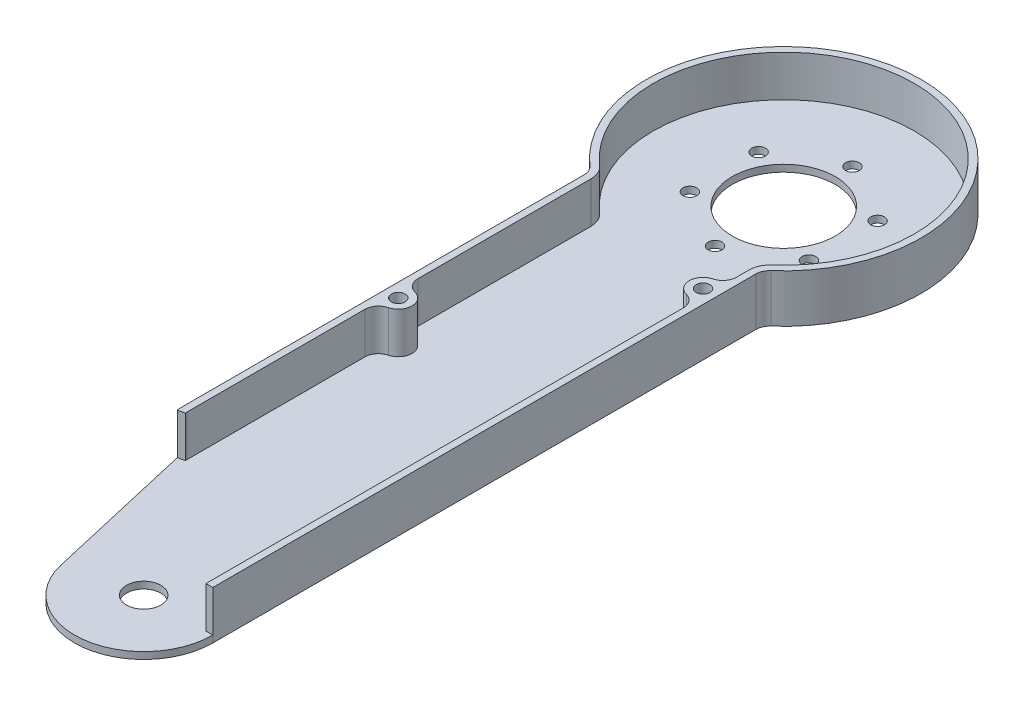
from build123d import *

# Parameters (mm, degrees)
SKETCH1_R           = 1.27
SKETCH1_R_2         = 3.175
SKETCH1_R_3         = 9.525
BOSS_EXTRUDE1_DEPTH = 8.89
FILLET1_R           = 2.54
SHELL2_START        = 1.27
SHELL2_OUTLINE_R    = 3.175
SHELL2_OUTLINE_R_2  = 1.27
SHELL2_OUTLINE_R_3  = 9.525
SHELL2_DEPTH        = 7.62
FILLET2_R           = 2.54


# Read off the part's stored shape, not the designer's step: Shell2
with BuildPart() as part:
    # Sketch1 → Boss-Extrude1 (new body)
    with BuildSketch(Plane(origin=(0, 0, 0), x_dir=(1, 0, 0), z_dir=(0, 1, 0))):
        with BuildLine():
            Line((-15.875, -19.827868645), (-15.875, -96.027868645))
            Line((-15.875, -96.027868645), (-9.362396438, -124.297332186))
            ThreePointArc((-9.362396438, -124.297332186), (4.537150087, -134.127868645), (15.875, -121.427868645))
            Line((15.875, -121.427868645), (15.875, -96.027868645))
            Line((15.875, -96.027868645), (15.875, -19.827868645))
            ThreePointArc((15.875, -19.827868645), (0, 25.4), (-15.875, -19.827868645))
        make_face()
        with Locations(Location((0, 12.7, 0), (0, 0, 270))):
            Circle(SKETCH1_R, mode=Mode.SUBTRACT)
        with Locations(Location((10.998522628, 6.35, 0), (0, 0, 270))):
            Circle(SKETCH1_R, mode=Mode.SUBTRACT)
        with Locations(Location((10.998522628, -6.35, 0), (0, 0, 270))):
            Circle(SKETCH1_R, mode=Mode.SUBTRACT)
        with Locations(Location((0, -12.7, 0), (0, 0, 270))):
            Circle(SKETCH1_R, mode=Mode.SUBTRACT)
        with Locations(Location((-10.998522628, -6.35, 0), (0, 0, 270))):
            Circle(SKETCH1_R, mode=Mode.SUBTRACT)
        with Locations(Location((-10.998522628, 6.35, 0), (0, 0, 270))):
            Circle(SKETCH1_R, mode=Mode.SUBTRACT)
        with Locations(Location((3.093174395, -121.427868645, 0), (0, 0, 270))):
            Circle(SKETCH1_R_2, mode=Mode.SUBTRACT)
        with Locations(Location((-13.335, -57.927868645, 0), (0, 0, 270))):
            Circle(SKETCH1_R, mode=Mode.SUBTRACT)
        with Locations(Location((13.335, -28.25059986, 0), (0, 0, 270))):
            Circle(SKETCH1_R, mode=Mode.SUBTRACT)
        with Locations(Location((0, 0, 0), (0, 0, 270))):
            Circle(SKETCH1_R_3, mode=Mode.SUBTRACT)
    extrude(amount=BOSS_EXTRUDE1_DEPTH)

    # Fillet1
    fillet1_edges = [part.edges().sort_by_distance(p)[0] for p in [
        (15.875, 4.445, 19.827868645),
        (-15.875, 4.445, 96.027868645),
        (-15.875, 4.445, 19.827868645),
    ]]
    fillet(fillet1_edges, radius=FILLET1_R)

    # Shell2 outline → Shell2 (cut)
    with BuildSketch(Plane(origin=(0, 0, 0), x_dir=(1, 0, 0), z_dir=(0, 1, 0)).offset(SHELL2_START)):
        with BuildLine():
            Line((14.605, -121.427868645), (14.605, -30.450304386))
            ThreePointArc((14.605, -30.450304386), (10.795, -28.25059986), (14.605, -26.050895335))
            Line((14.605, -26.050895335), (14.605, -21.012647977))
            ThreePointArc((14.605, -21.012647977), (14.944875395, -19.439645997), (15.903863636, -18.147286889))
            ThreePointArc((15.903863636, -18.147286889), (0, 24.13), (-15.903863636, -18.147286889))
            ThreePointArc((-15.903863636, -18.147286889), (-14.944875395, -19.439645997), (-14.605, -21.012647977))
            Line((-14.605, -21.012647977), (-14.605, -55.728164119))
            ThreePointArc((-14.605, -55.728164119), (-10.795, -57.927868645), (-14.605, -60.127573171))
            Line((-14.605, -60.127573171), (-14.605, -95.739073507))
            ThreePointArc((-14.605, -95.739073507), (-14.596869822, -95.882546684), (-14.572583382, -96.024182912))
            Line((-14.572583382, -96.024182912), (-15.810166764, -96.309292317))
            Line((-15.810166764, -96.309292317), (-9.362396438, -124.297332186))
            ThreePointArc((-9.362396438, -124.297332186), (4.537150087, -134.127868645), (15.875, -121.427868645))
            Line((15.875, -121.427868645), (14.605, -121.427868645))
        make_face()
        with Locations((3.093174395, -121.427868645)):
            Circle(SHELL2_OUTLINE_R, mode=Mode.SUBTRACT)
        with Locations((-10.998522628, -6.35)):
            Circle(SHELL2_OUTLINE_R_2, mode=Mode.SUBTRACT)
        with Locations((0, -12.7)):
            Circle(SHELL2_OUTLINE_R_2, mode=Mode.SUBTRACT)
        Circle(SHELL2_OUTLINE_R_3, mode=Mode.SUBTRACT)
        with Locations((-10.998522628, 6.35)):
            Circle(SHELL2_OUTLINE_R_2, mode=Mode.SUBTRACT)
        with Locations((0, 12.7)):
            Circle(SHELL2_OUTLINE_R_2, mode=Mode.SUBTRACT)
        with Locations((10.998522628, -6.35)):
            Circle(SHELL2_OUTLINE_R_2, mode=Mode.SUBTRACT)
        with Locations((10.998522628, 6.35)):
            Circle(SHELL2_OUTLINE_R_2, mode=Mode.SUBTRACT)
    extrude(amount=SHELL2_DEPTH, mode=Mode.SUBTRACT)

    # Fillet2
    fillet2_edges = [part.edges().sort_by_distance(p)[0] for p in [
        (14.605, 5.08, 30.450304386),
        (-14.605, 5.08, 55.728164119),
        (-14.605, 5.08, 60.127573171),
        (14.605, 5.08, 26.050895335),
    ]]
    fillet(fillet2_edges, radius=FILLET2_R)


solid = part.part
